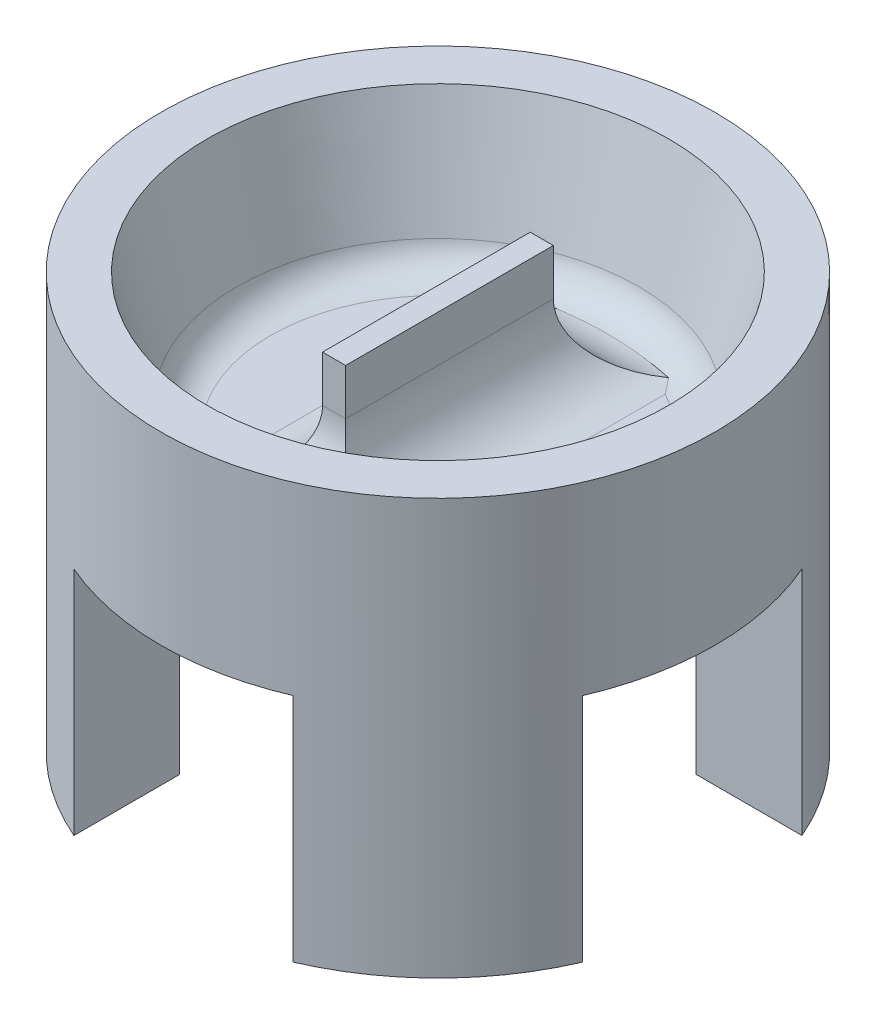
from build123d import *

# Parameters (mm, degrees)
BOSS_EXTRUDE1_DEPTH = 15
SKETCH2_R           = 6
BOSS_EXTRUDE2_DEPTH = 5
SKETCH2_2_R         = 6
BOSS_EXTRUDE3_DEPTH = 1
BOSS_EXTRUDE4_START = 1
SKETCH3_W           = 0.5
SKETCH3_H           = 4.5
BOSS_EXTRUDE4_DEPTH = 2.5
FILLET1_R           = 1.5
FILLET2_R           = 1.5


with BuildPart() as part:
    # Sketch1 → Boss-Extrude1 (new body)
    with BuildSketch(Plane(origin=(0, 0, 0), x_dir=(1, 0, 0), z_dir=(0, 1, 0))):
        with BuildLine():
            Line((-2.375, 10), (2.375, 10))
            Line((2.375, 10), (2.375, 3.218598297))
            ThreePointArc((2.375, 3.218598297), (2.828427125, 2.828427125), (3.218598297, 2.375))
            Line((3.218598297, 2.375), (10, 2.375))
            Line((10, 2.375), (10, -2.375))
            Line((10, -2.375), (3.218598297, -2.375))
            ThreePointArc((3.218598297, -2.375), (2.828427125, -2.828427125), (2.375, -3.218598297))
            Line((2.375, -3.218598297), (2.375, -10))
            Line((2.375, -10), (-2.375, -10))
            Line((-2.375, -10), (-2.375, -3.218598297))
            ThreePointArc((-2.375, -3.218598297), (-2.828427125, -2.828427125), (-3.218598297, -2.375))
            Line((-3.218598297, -2.375), (-10, -2.375))
            Line((-10, -2.375), (-10, 2.375))
            Line((-10, 2.375), (-3.218598297, 2.375))
            ThreePointArc((-3.218598297, 2.375), (-2.828427125, 2.828427125), (-2.375, 3.218598297))
            Line((-2.375, 3.218598297), (-2.375, 10))
        make_face()
    extrude(amount=-BOSS_EXTRUDE1_DEPTH)


with BuildPart() as body_2:
    # Sketch2 → Boss-Extrude2 (new body)
    with BuildSketch(Plane(origin=(0, 0, 0), x_dir=(1, 0, 0), z_dir=(0, 1, 0))):
        with Locations(Location((0, 0, 0), (0, 0, 270))):
            Circle(SKETCH2_R)
    extrude(amount=-BOSS_EXTRUDE2_DEPTH)

    # Sketch2<2> → Boss-Extrude3 (add)
    with BuildSketch(Plane(origin=(0, 0, 0), x_dir=(1, 0, 0), z_dir=(0, 1, 0))):
        with Locations(Location((0, 0, 0), (0, 0, 270))):
            Circle(SKETCH2_2_R)
    extrude(amount=BOSS_EXTRUDE3_DEPTH)

    # Combine1: cut part
    add(part.part, mode=Mode.SUBTRACT)

    # Sketch3 → Boss-Extrude4 (add)
    with BuildSketch(Plane(origin=(0, 0, 0), x_dir=(1, 0, 0), z_dir=(0, 1, 0)).offset(BOSS_EXTRUDE4_START)):
        Rectangle(SKETCH3_W, SKETCH3_H)
    extrude(amount=BOSS_EXTRUDE4_DEPTH)

    # Fillet1
    fillet1_edges = [body_2.edges().sort_by_distance(p)[0] for p in [
        (0.25, 1, 0),
        (-0.25, 1, 0),
    ]]
    fillet(fillet1_edges, radius=FILLET1_R)

    # Fillet2
    fillet2_edges = [body_2.edges().sort_by_distance(p)[0] for p in [
        (0, 1, -2.25),
        (0, 1, 2.25),
    ]]
    fillet(fillet2_edges, radius=FILLET2_R)

    # Sketch4 → Revolve1 (revolve)
    with BuildSketch(Plane(origin=(0, 0, 0), x_dir=(0, 0, -1), z_dir=(1, 0, 0)), mode=Mode.PRIVATE) as revolve1_sk:
        Polygon((-6, 1), (-6, 4), (-5, 4), (-4.2, 1), align=None)
    revolve(revolve1_sk.sketch.rotate(Axis((0, 0, 0), (0, 1, 0)), 180), axis=Axis((0, 0, 0), (0, 1, 0)))

    # Fillet3: read off the stored shape, not the designer's step
    # Fillet3 outline → Fillet3 (revolve)
    with BuildSketch(Plane.XY):
        with BuildLine():
            ThreePointArc((4.34846747, 1.556753012), (4.08071837, 1.155258358), (3.623791265, 1))
            Line((3.623791265, 1), (4.34846747, 1))
            Line((4.34846747, 1), (4.34846747, 1.556753012))
        make_face()
    revolve(axis=Axis((0, 0, 0), (0, 1, 0)))


solid = body_2.part
